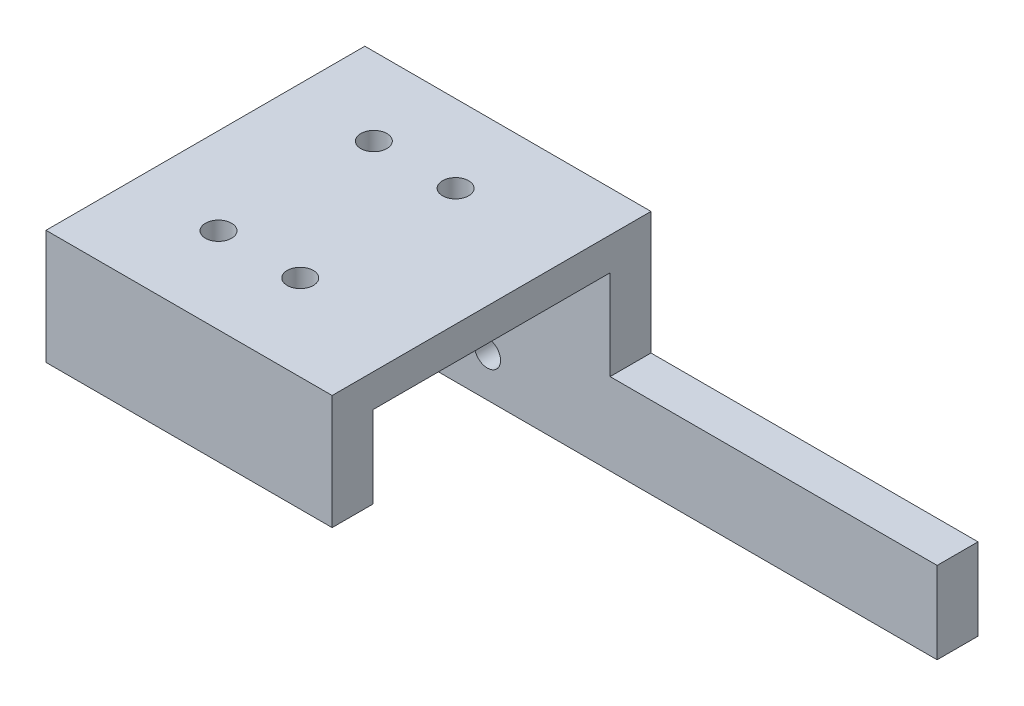
from build123d import *

# Parameters (mm, degrees)
SKETCH_1_W          = 35
SKETCH_1_H          = 39
EXTRUDE_1_DEPTH     = 4
SKETCH_2_R          = 1.6
CUT_EXTRUDE_1_DEPTH = 6
SKETCH_3_W          = 35
SKETCH_3_H          = 5
EXTRUDE_2_DEPTH     = 21
SKETCH_4_R          = 1.6
CUT_EXTRUDE_2_DEPTH = 15
SKETCH_5_R          = 2.8
CUT_EXTRUDE_3_DEPTH = 2
SKETCH_6_W          = 40
SKETCH_6_H          = 10
EXTRUDE_3_DEPTH     = 5
SKETCH_7_W          = 35
SKETCH_7_H          = 5
EXTRUDE_4_DEPTH     = 10


with BuildPart() as part:
    # 草图1 → 凸台-拉伸1 (new body)
    with BuildSketch(Plane(origin=(0, 0, 0), x_dir=(1, 0, 0), z_dir=(0, 1, 0))):
        with Locations((17.5, 19.5)):
            Rectangle(SKETCH_1_W, SKETCH_1_H)
    extrude(amount=EXTRUDE_1_DEPTH)

    # 草图2 → 切除-拉伸1 (cut)
    with BuildSketch(Plane(origin=(0, 4, 0), x_dir=(1, 0, 0), z_dir=(0, 1, 0))):
        with Locations((10.6, 29.5)):
            Circle(SKETCH_2_R)
        with Locations((20.6, 29.5)):
            Circle(SKETCH_2_R)
        with Locations((20.6, 10.5)):
            Circle(SKETCH_2_R)
        with Locations((10.6, 10.5)):
            Circle(SKETCH_2_R)
    extrude(amount=-CUT_EXTRUDE_1_DEPTH, mode=Mode.SUBTRACT)

    # 草图3 → 凸台-拉伸2 (add)
    with BuildSketch(Plane.XZ):
        with Locations((17.5, -36.5)):
            Rectangle(SKETCH_3_W, SKETCH_3_H)
    extrude(amount=EXTRUDE_2_DEPTH)

    # 草图4 → 切除-拉伸2 (cut)
    with BuildSketch(Plane(origin=(0, 0, -39), x_dir=(-1, 0, 0), z_dir=(0, 0, -1))):
        with Locations((-10, -16)):
            Circle(SKETCH_4_R)
        with Locations((-20, -16)):
            Circle(SKETCH_4_R)
    extrude(amount=-CUT_EXTRUDE_2_DEPTH, mode=Mode.SUBTRACT)

    # 草图5 → 切除-拉伸3 (cut)
    with BuildSketch(Plane(origin=(0, 0, -39), x_dir=(-1, 0, 0), z_dir=(0, 0, -1))):
        with Locations((-20, -16)):
            Circle(SKETCH_5_R)
        with Locations((-10, -16)):
            Circle(SKETCH_5_R)
    extrude(amount=-CUT_EXTRUDE_3_DEPTH, mode=Mode.SUBTRACT)

    # 草图6 → 凸台-拉伸3 (add)
    with BuildSketch(Plane(origin=(0, 0, -39), x_dir=(-1, 0, 0), z_dir=(0, 0, -1))):
        with Locations((-55, -16)):
            Rectangle(SKETCH_6_W, SKETCH_6_H)
    extrude(amount=-EXTRUDE_3_DEPTH)

    # 草图7 → 凸台-拉伸4 (add)
    with BuildSketch(Plane.XZ):
        with Locations((17.5, -2.5)):
            Rectangle(SKETCH_7_W, SKETCH_7_H)
    extrude(amount=EXTRUDE_4_DEPTH)


solid = part.part
